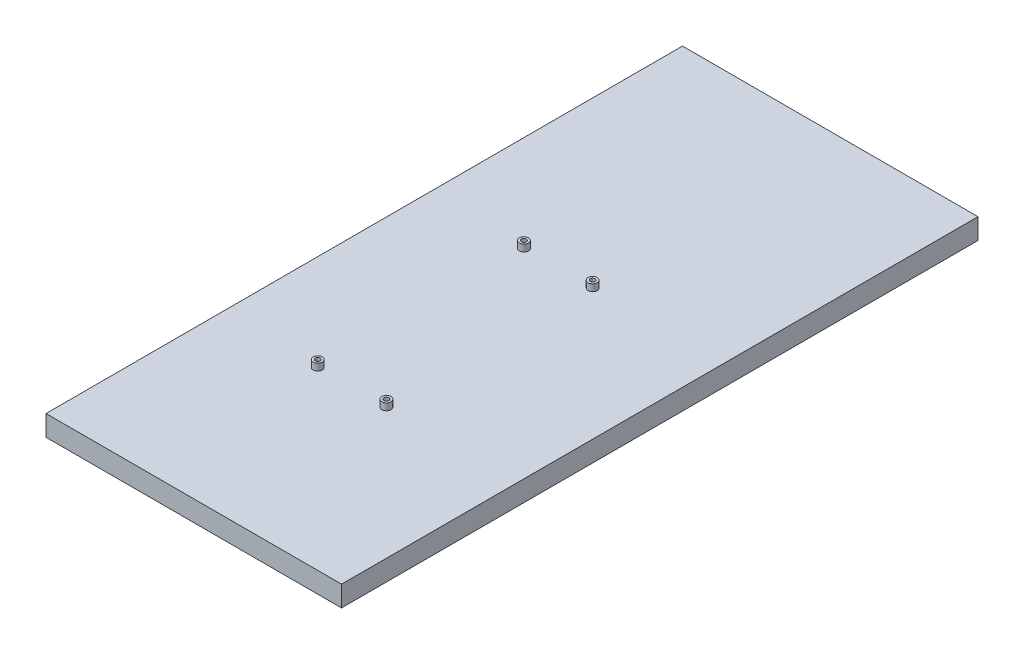
from build123d import *

# Parameters (mm, degrees)
SKETCH1_W           = 430
SKETCH1_H           = 463
BOSS_EXTRUDE1_DEPTH = 15
SKETCH7_R           = 3.3
BOSS_EXTRUDE2_DEPTH = 5
SKETCH8_R           = 1.75
CUT_EXTRUDE1_DEPTH  = 4
SKETCH6_R           = 3.3
BOSS_EXTRUDE3_DEPTH = 5
SKETCH10_R          = 1.75
CUT_EXTRUDE2_DEPTH  = 4
SKETCH12_R          = 3.8
CUT_EXTRUDE3_DEPTH  = 10
CUT_EXTRUDE4_DEPTH  = 317.571082065


with BuildPart() as part:
    # Sketch1 → Boss-Extrude1 (new body)
    with BuildSketch(Plane(origin=(0, 0, 0), x_dir=(1, 0, 0), z_dir=(0, 1, 0))):
        Rectangle(SKETCH1_W, SKETCH1_H)
    extrude(amount=BOSS_EXTRUDE1_DEPTH)

    # Sketch7 → Boss-Extrude2 (add)
    with BuildSketch(Plane(origin=(0, 15, 0), x_dir=(1, 0, 0), z_dir=(0, 1, 0))):
        with Locations((-116.362714529, 94.945868521)):
            Circle(SKETCH7_R)
        with Locations((-55.363204635, 95.191638193)):
            Circle(SKETCH7_R)
        with Locations((-54.980448566, 0.192396061)):
            Circle(SKETCH7_R)
        with Locations((-115.97995846, -0.053373612)):
            Circle(SKETCH7_R)
    extrude(amount=BOSS_EXTRUDE2_DEPTH)

    # Sketch8 → Cut-Extrude1 (cut)
    with BuildSketch(Plane(origin=(0, 20, 0), x_dir=(1, 0, 0), z_dir=(0, 1, 0))):
        with Locations((-54.980448566, 0.192396061)):
            Circle(SKETCH8_R)
        with Locations((-55.363204635, 95.191638193)):
            Circle(SKETCH8_R)
        with Locations((-116.362714529, 94.945868521)):
            Circle(SKETCH8_R)
        with Locations((-115.97995846, -0.053373612)):
            Circle(SKETCH8_R)
    extrude(amount=-CUT_EXTRUDE1_DEPTH, mode=Mode.SUBTRACT)

    # Sketch6 → Boss-Extrude3 (add)
    with BuildSketch(Plane(origin=(0, 15, 0), x_dir=(1, 0, 0), z_dir=(0, 1, 0))):
        with Locations((119.793345796, 46.373061352)):
            Circle(SKETCH6_R)
        with Locations((69.793345796, 46.373061352)):
            Circle(SKETCH6_R)
        with Locations((119.793345796, -103.626938648)):
            Circle(SKETCH6_R)
        with Locations((69.793345796, -103.626938648)):
            Circle(SKETCH6_R)
    extrude(amount=BOSS_EXTRUDE3_DEPTH)

    # Sketch10 → Cut-Extrude2 (cut)
    with BuildSketch(Plane(origin=(0, 20, 0), x_dir=(1, 0, 0), z_dir=(0, 1, 0))):
        with Locations((69.793345796, 46.373061352)):
            Circle(SKETCH10_R)
        with Locations((119.793345796, 46.373061352)):
            Circle(SKETCH10_R)
        with Locations((119.793345796, -103.626938648)):
            Circle(SKETCH10_R)
        with Locations((69.793345796, -103.626938648)):
            Circle(SKETCH10_R)
    extrude(amount=-CUT_EXTRUDE2_DEPTH, mode=Mode.SUBTRACT)

    # Sketch12 → Cut-Extrude3 (cut)
    with BuildSketch(Plane(origin=(0, 0, 0), x_dir=(-1, 0, 0), z_dir=(0, -1, 0))):
        with Locations((-183.528683765, -175)):
            Circle(SKETCH12_R)
        with Locations((-203.398904111, 170)):
            Circle(SKETCH12_R)
        with Locations((-183.528683765, 10)):
            Circle(SKETCH12_R)
        with Locations((-203.398904111, 10)):
            Circle(SKETCH12_R)
        with Locations((-203.398904111, -175)):
            Circle(SKETCH12_R)
        with Locations((-183.528683765, 170)):
            Circle(SKETCH12_R)
        with Locations((206.525269648, -175)):
            Circle(SKETCH12_R)
        with Locations((206.525269648, 20)):
            Circle(SKETCH12_R)
        with Locations((186.44692003, 175)):
            Circle(SKETCH12_R)
        with Locations((206.52526965, 175)):
            Circle(SKETCH12_R)
        with Locations((186.44692003, -175)):
            Circle(SKETCH12_R)
        with Locations((186.446920025, 20)):
            Circle(SKETCH12_R)
        with Locations((160.349922153, -221.520559324)):
            Circle(SKETCH12_R)
        with Locations((160.349922153, -201.54839577)):
            Circle(SKETCH12_R)
        with Locations((20, -221.520559324)):
            Circle(SKETCH12_R)
        with Locations((20, -201.548395767)):
            Circle(SKETCH12_R)
        with Locations((-20, -201.54839577)):
            Circle(SKETCH12_R)
        with Locations((-20, -221.52055932)):
            Circle(SKETCH12_R)
        with Locations((-160, -221.52055932)):
            Circle(SKETCH12_R)
        with Locations((-160, -201.54839577)):
            Circle(SKETCH12_R)
        with Locations((160, 201.06768193)):
            Circle(SKETCH12_R)
        with Locations((160, 221.0363788)):
            Circle(SKETCH12_R)
        with Locations((20, 201.06768193)):
            Circle(SKETCH12_R)
        with Locations((20, 221.0363788)):
            Circle(SKETCH12_R)
        with Locations((-20, 201.06768193)):
            Circle(SKETCH12_R)
        with Locations((-20, 221.0363788)):
            Circle(SKETCH12_R)
        with Locations((-160, 201.067681927)):
            Circle(SKETCH12_R)
        with Locations((-160, 221.036378797)):
            Circle(SKETCH12_R)
    extrude(amount=-CUT_EXTRUDE3_DEPTH, mode=Mode.SUBTRACT)

    # Sketch13 → Cut-Extrude4 (cut, through all)
    with BuildSketch(Plane.ZY):
        Polygon((-231.5, 15), (-231.5, 27.636354085), (231.5, 28.029367039), (231.5, 15), (231.5, 0), (-231.5, 0), align=None)
    extrude(amount=CUT_EXTRUDE4_DEPTH, mode=Mode.SUBTRACT)


solid = part.part
